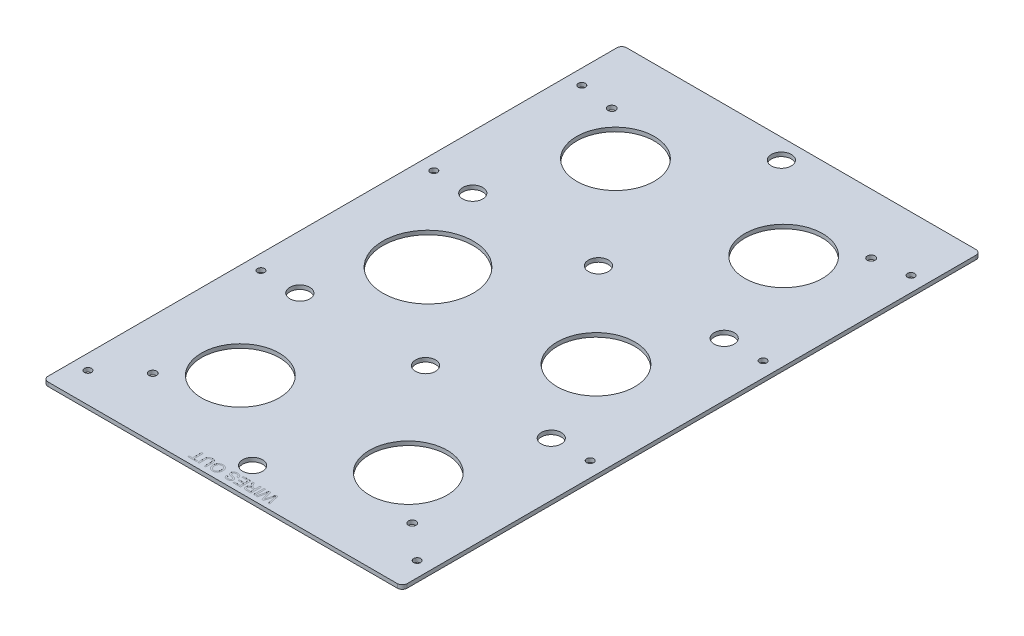
from build123d import *

# Parameters (mm, degrees)
SKETCH1_R           = 24.727
SKETCH1_R_2         = 28.76928198
SKETCH1_R_3         = 6.35
SKETCH1_R_4         = 2.45745
SKETCH1_R_5         = 2.2479
BOSS_EXTRUDE1_DEPTH = 2.54
SKETCH2_W           = 0.941716851
SKETCH2_H           = 6.677628581
CUT_EXTRUDE2_DEPTH  = 0.0254


with BuildPart() as part:
    # Sketch1 → Boss-Extrude1 (new body)
    with BuildSketch(Plane(origin=(0, 0, 0), x_dir=(1, 0, 0), z_dir=(0, 1, 0))):
        with BuildLine():
            Line((-109.77845824, -117.604731416), (112.47154176, -117.604731416))
            ThreePointArc((112.47154176, -117.604731416), (114.71660579, -118.534667386), (115.64654176, -120.779731416))
            Line((115.64654176, -120.779731416), (115.64654176, -482.729731416))
            ThreePointArc((115.64654176, -482.729731416), (114.71660579, -484.974795446), (112.47154176, -485.904731416))
            Line((112.47154176, -485.904731416), (-109.77845824, -485.904731416))
            ThreePointArc((-109.77845824, -485.904731416), (-112.023522271, -484.974795446), (-112.95345824, -482.729731416))
            Line((-112.95345824, -482.729731416), (-112.95345824, -120.779731416))
            ThreePointArc((-112.95345824, -120.779731416), (-112.023522271, -118.534667386), (-109.77845824, -117.604731416))
        make_face()
        with Locations((54.86434176, -421.2633131)):
            Circle(SKETCH1_R, mode=Mode.SUBTRACT)
        with Locations((54.86434176, -301.819022258)):
            Circle(SKETCH1_R, mode=Mode.SUBTRACT)
        with Locations((-52.17125824, -421.134731416)):
            Circle(SKETCH1_R, mode=Mode.SUBTRACT)
        with Locations((-52.17125824, -182.374731416)):
            Circle(SKETCH1_R, mode=Mode.SUBTRACT)
        with Locations((54.86434176, -182.374731416)):
            Circle(SKETCH1_R, mode=Mode.SUBTRACT)
        with Locations((-52.17125824, -301.690440574)):
            Circle(SKETCH1_R_2, mode=Mode.SUBTRACT)
        with Locations((1.34654176, -466.854731416)):
            Circle(SKETCH1_R_3, mode=Mode.SUBTRACT)
        with Locations((81.35654176, -356.783831416)):
            Circle(SKETCH1_R_3, mode=Mode.SUBTRACT)
        with Locations((1.34654176, -356.788064749)):
            Circle(SKETCH1_R_3, mode=Mode.SUBTRACT)
        with Locations((-78.66345824, -356.783831416)):
            Circle(SKETCH1_R_3, mode=Mode.SUBTRACT)
        with Locations((81.35654176, -246.725631416)):
            Circle(SKETCH1_R_3, mode=Mode.SUBTRACT)
        with Locations((1.34654176, -246.721398083)):
            Circle(SKETCH1_R_3, mode=Mode.SUBTRACT)
        with Locations((-78.66345824, -246.725631416)):
            Circle(SKETCH1_R_3, mode=Mode.SUBTRACT)
        with Locations((1.34654176, -130.304731416)):
            Circle(SKETCH1_R_3, mode=Mode.SUBTRACT)
        with Locations((83.89654176, -155.704731416)):
            Circle(SKETCH1_R_4, mode=Mode.SUBTRACT)
        with Locations((-81.20345824, -155.704731416)):
            Circle(SKETCH1_R_4, mode=Mode.SUBTRACT)
        with Locations((-81.20345824, -447.804731416)):
            Circle(SKETCH1_R_4, mode=Mode.SUBTRACT)
        with Locations((83.89654176, -447.804731416)):
            Circle(SKETCH1_R_4, mode=Mode.SUBTRACT)
        with Locations((-103.42845824, -152.529731416)):
            Circle(SKETCH1_R_5, mode=Mode.SUBTRACT)
        with Locations((-103.42845824, -246.721398083)):
            Circle(SKETCH1_R_5, mode=Mode.SUBTRACT)
        with Locations((106.12154176, -152.529731416)):
            Circle(SKETCH1_R_5, mode=Mode.SUBTRACT)
        with Locations((106.12154176, -246.721398083)):
            Circle(SKETCH1_R_5, mode=Mode.SUBTRACT)
        with Locations((106.12154176, -356.788064749)):
            Circle(SKETCH1_R_5, mode=Mode.SUBTRACT)
        with Locations((-103.42845824, -356.788064749)):
            Circle(SKETCH1_R_5, mode=Mode.SUBTRACT)
        with Locations((-103.42845824, -466.854731416)):
            Circle(SKETCH1_R_5, mode=Mode.SUBTRACT)
        with Locations((106.12154176, -466.854731416)):
            Circle(SKETCH1_R_5, mode=Mode.SUBTRACT)
    extrude(amount=BOSS_EXTRUDE1_DEPTH)

    # Sketch2 → Cut-Extrude2 (cut)
    # profile 1 of 8: a face of its own
    with BuildSketch(Plane(origin=(0, 2.54, 0), x_dir=(1, 0, 0), z_dir=(0, 1, 0))):
        with BuildLine():
            Line((26.372131973, -475.904731416), (28.053578112, -482.582359997))
            Line((28.053578112, -482.582359997), (27.081094943, -482.582359997))
            Line((27.081094943, -482.582359997), (26.089884451, -478.190802579))
            add(Edge.make_bspline(
                [(26.089884451, -478.190802579), (26.038513758, -477.964312224), (25.936296825, -477.513643795), (25.835190428, -477.062724924), (25.784896607, -476.838422271)],
                knots=[0, 0, 0, 0, 1.00513078, 2, 2, 2, 2], degree=3))
            add(Edge.make_bspline(
                [(25.784896607, -476.838422271), (25.761084061, -476.919075954), (25.716130312, -477.07133541), (25.655361557, -477.28717786), (25.600167243, -477.47555915), (25.55314452, -477.637357484), (25.515070403, -477.772800178), (25.482197643, -477.880222921), (25.459791981, -477.961729399), (25.446514345, -478.006664191), (25.44111645, -478.024931997)],
                knots=[0, 0, 0, 0, 1.633809233, 3.084334118, 4.356383392, 5.447555203, 6.357852567, 7.089694452, 7.629924063, 8, 8, 8, 8], degree=3))
            Line((25.44111645, -478.024931997), (24.122177792, -482.582359997))
            Line((24.122177792, -482.582359997), (22.989174705, -482.582359997))
            Line((22.989174705, -482.582359997), (22.03541886, -479.236857377))
            add(Edge.make_bspline(
                [(22.03541886, -479.236857377), (21.982784819, -479.030185346), (21.879001879, -478.622672829), (21.741109494, -478.01566784), (21.61383923, -477.423388915), (21.540529167, -477.031660892), (21.504365466, -476.838422271)],
                knots=[0, 0, 0, 0, 1.04154457, 2.053700482, 3.039894486, 4, 4, 4, 4], degree=3))
            add(Edge.make_bspline(
                [(21.504365466, -476.838422271), (21.481984929, -476.936944292), (21.434706341, -477.14507076), (21.362000235, -477.473539991), (21.279481876, -477.83395597), (21.223338384, -478.085100536), (21.194026958, -478.216218233)],
                knots=[0, 0, 0, 0, 0.858436457, 1.813435672, 2.858437265, 4, 4, 4, 4], degree=3))
            Line((21.194026958, -478.216218233), (20.208167129, -482.582359997))
            Line((20.208167129, -482.582359997), (19.235683961, -482.582359997))
            Line((19.235683961, -482.582359997), (20.918467766, -475.904731416))
            Line((20.918467766, -475.904731416), (21.953821235, -475.904731416))
            Line((21.953821235, -475.904731416), (23.349006854, -481.007927136))
            add(Edge.make_bspline(
                [(23.349006854, -481.007927136), (23.363016528, -481.057815617), (23.38962969, -481.152585154), (23.424513314, -481.287824496), (23.45910635, -481.406761932), (23.486621699, -481.510934535), (23.51043393, -481.599292569), (23.531520679, -481.671577335), (23.545083109, -481.729203562), (23.554890828, -481.761956596), (23.559020413, -481.77574741)],
                knots=[0, 0, 0, 0, 1.562239628, 2.967673567, 4.210417925, 5.296319877, 6.215971374, 6.969386481, 7.566055473, 8, 8, 8, 8], degree=3))
            add(Edge.make_bspline(
                [(23.559020413, -481.77574741), (23.583846032, -481.688311611), (23.630871147, -481.522689209), (23.69935552, -481.289823335), (23.758234909, -481.085483445), (23.79487651, -480.959319766), (23.811839284, -480.900913858)],
                knots=[0, 0, 0, 0, 1.197732026, 2.268764715, 3.198546125, 4, 4, 4, 4], degree=3))
            Line((23.811839284, -480.900913858), (25.25785621, -475.904731416))
            Line((25.25785621, -475.904731416), (26.372131973, -475.904731416))
        make_face()
    # profile 2 of 8: a face of its own
    with BuildSketch(Plane(origin=(0, 2.54, 0), x_dir=(1, 0, 0), z_dir=(0, 1, 0))):
        with Locations((18.079940552, -479.243545707)):
            Rectangle(SKETCH2_W, SKETCH2_H)
    # profile 3 of 8: a face of its own
    with BuildSketch(Plane(origin=(0, 2.54, 0), x_dir=(1, 0, 0), z_dir=(0, 1, 0))):
        with BuildLine():
            Line((16.068090916, -475.904731416), (16.068090916, -482.582359997))
            Line((16.068090916, -482.582359997), (13.170706399, -482.582359997))
            add(Edge.make_bspline(
                [(13.170706399, -482.582359997), (13.102481541, -482.581827962), (12.970440312, -482.580798272), (12.778958565, -482.573440351), (12.600651852, -482.557808443), (12.434396409, -482.540349513), (12.280476723, -482.514571062), (12.13881944, -482.48432829), (12.009967848, -482.448584849), (11.892941528, -482.40633462), (11.784357797, -482.358550478), (11.683737524, -482.299559989), (11.58676027, -482.235030329), (11.497291762, -482.158586204), (11.41130237, -482.076455256), (11.332392217, -481.98452804), (11.25822596, -481.885105409), (11.16804959, -481.741131601), (11.073339849, -481.548144969), (10.991764744, -481.302957418), (10.939893748, -481.046216606), (10.934294461, -480.870841687), (10.931453546, -480.781861585)],
                knots=[0, 0, 0, 0, 1.242075696, 2.40389213, 3.487198984, 4.500157661, 5.446319301, 6.326791195, 7.136300648, 7.878370406, 8.590488565, 9.292260633, 9.999224673, 10.708050372, 11.431369221, 12.162165018, 12.910600795, 13.687589445, 15.252257874, 16.810406251, 18.381693487, 20, 20, 20, 20], degree=3))
            add(Edge.make_bspline(
                [(10.931453546, -480.781861585), (10.932760252, -480.724740088), (10.935341085, -480.611921213), (10.955110239, -480.446047086), (10.990881693, -480.287561728), (11.036749024, -480.135073876), (11.099536767, -479.990755988), (11.172240397, -479.851615869), (11.262436911, -479.721641487), (11.363146153, -479.596488972), (11.480252773, -479.481806219), (11.610515046, -479.375811763), (11.757849182, -479.284850699), (11.917422891, -479.200318383), (12.093348641, -479.130895346), (12.282973305, -479.069766111), (12.487764473, -479.022633746), (12.629708281, -478.998892657), (12.702523306, -478.986713838)],
                knots=[0, 0, 0, 0, 0.982645791, 1.940792824, 2.867691729, 3.775150443, 4.675643875, 5.571354211, 6.471357401, 7.392684514, 8.331098131, 9.285922955, 10.275520706, 11.304845665, 12.388884831, 13.524255008, 14.729980297, 16, 16, 16, 16], degree=3))
            add(Edge.make_bspline(
                [(12.702523306, -478.986713838), (12.648592947, -478.95983205), (12.546318845, -478.908853145), (12.407145687, -478.824504804), (12.285223811, -478.745098059), (12.215967152, -478.685554196), (12.183508905, -478.657648006)],
                knots=[0, 0, 0, 0, 1.172551213, 2.223638478, 3.167479604, 4, 4, 4, 4], degree=3))
            add(Edge.make_bspline(
                [(12.183508905, -478.657648006), (12.120320754, -478.595895573), (11.990732262, -478.4692515), (11.81389184, -478.251539052), (11.63891035, -478.01211767), (11.533855118, -477.8376469), (11.479896599, -477.748035139)],
                knots=[0, 0, 0, 0, 0.918170575, 1.883016652, 2.912673989, 4, 4, 4, 4], degree=3))
            Line((11.479896599, -477.748035139), (10.38434816, -475.904731416))
            Line((10.38434816, -475.904731416), (11.463844607, -475.904731416))
            Line((11.463844607, -475.904731416), (12.295872847, -477.314631361))
            add(Edge.make_bspline(
                [(12.295872847, -477.314631361), (12.325790236, -477.364098167), (12.383765222, -477.459956715), (12.467478002, -477.599973664), (12.54966608, -477.728808538), (12.625523723, -477.850471976), (12.699861709, -477.961755466), (12.76650074, -478.066870579), (12.833423708, -478.159862494), (12.910266128, -478.271581699), (13.004109879, -478.392370364), (13.113618902, -478.516455456), (13.214305162, -478.619242035), (13.34153795, -478.717314097), (13.499745251, -478.807108645), (13.633136567, -478.849704776), (13.697746796, -478.870336898)],
                knots=[0, 0, 0, 0, 1.130591283, 2.190900266, 3.190104209, 4.119071823, 4.994606968, 5.807262858, 6.55236009, 7.234593472, 8.459046683, 9.540234366, 10.471327768, 11.266723835, 12.676093724, 14, 14, 14, 14], degree=3))
            add(Edge.make_bspline(
                [(13.697746796, -478.870336898), (13.724889433, -478.875231638), (13.786856888, -478.886406476), (13.89207747, -478.89370478), (14.019565115, -478.901450954), (14.111957583, -478.901225256), (14.161916892, -478.901103215)],
                knots=[0, 0, 0, 0, 0.709978628, 1.620902492, 2.713552433, 4, 4, 4, 4], degree=3))
            Line((14.161916892, -478.901103215), (15.126374065, -478.901103215))
            Line((15.126374065, -478.901103215), (15.126374065, -475.904731416))
            Line((15.126374065, -475.904731416), (16.068090916, -475.904731416))
        make_face()
        with BuildLine():
            Line((15.126374065, -479.671598821), (13.337914647, -479.671598821))
            add(Edge.make_bspline(
                [(13.337914647, -479.671598821), (13.248230464, -479.672989815), (13.080574296, -479.67559015), (12.846193265, -479.698134703), (12.645703404, -479.733375071), (12.476543745, -479.786899254), (12.334381546, -479.858578696), (12.211169235, -479.946235717), (12.107569198, -480.054984869), (12.022367114, -480.17968191), (11.955762337, -480.315575815), (11.909222295, -480.459402831), (11.877976942, -480.608405004), (11.874782155, -480.710360449), (11.873170397, -480.761796596)],
                knots=[0, 0, 0, 0, 1.546056516, 2.890207646, 4.055830773, 5.050253158, 5.937355789, 6.790906573, 7.644595853, 8.512568064, 9.38593768, 10.244184789, 11.114197691, 12, 12, 12, 12], degree=3))
            add(Edge.make_bspline(
                [(11.873170397, -480.761796596), (11.874407733, -480.799281171), (11.876831311, -480.872702444), (11.889671729, -480.98042932), (11.914101739, -481.082517958), (11.947836256, -481.179704261), (11.990549077, -481.272199236), (12.043036377, -481.359639094), (12.105027325, -481.441577229), (12.17613821, -481.518417024), (12.257757732, -481.58834434), (12.350994391, -481.648673601), (12.455103649, -481.69994125), (12.570209115, -481.740630467), (12.695947439, -481.773175281), (12.833034639, -481.79482628), (12.980843722, -481.810492876), (13.083266847, -481.811398678), (13.135927084, -481.811864391)],
                knots=[0, 0, 0, 0, 0.965235723, 1.89061323, 2.787065514, 3.661873922, 4.534873316, 5.404925039, 6.281839248, 7.175200054, 8.095223355, 9.040740021, 10.02630299, 11.075573487, 12.177989335, 13.364883635, 14.645170704, 16, 16, 16, 16], degree=3))
            Line((13.135927084, -481.811864391), (15.126374065, -481.811864391))
            Line((15.126374065, -481.811864391), (15.126374065, -479.671598821))
        make_face(mode=Mode.SUBTRACT)
    # profile 4 of 8: a face of its own
    with BuildSketch(Plane(origin=(0, 2.54, 0), x_dir=(1, 0, 0), z_dir=(0, 1, 0))):
        Polygon((9.390462335, -475.904731416), (9.390462335, -482.582359997), (4.681878079, -482.582359997), (4.681878079, -481.811864391), (8.448745484, -481.811864391), (8.448745484, -479.757209443), (4.938709948, -479.757209443), (4.938709948, -478.986713838), (8.448745484, -478.986713838), (8.448745484, -476.675227022), (4.510656834, -476.675227022), (4.510656834, -475.904731416), align=None)
    # profile 5 of 8: a face of its own
    with BuildSketch(Plane(origin=(0, 2.54, 0), x_dir=(1, 0, 0), z_dir=(0, 1, 0))):
        with BuildLine():
            Line((3.568939983, -478.216218233), (2.627223132, -478.216218233))
            add(Edge.make_bspline(
                [(2.627223132, -478.216218233), (2.616888429, -478.131652183), (2.597034909, -477.969196247), (2.541083006, -477.739143921), (2.47059671, -477.531765305), (2.377850268, -477.347273237), (2.263933602, -477.181277245), (2.121405984, -477.034274944), (1.950254913, -476.905232553), (1.754515474, -476.794893332), (1.540336943, -476.7019483), (1.3096099, -476.636745749), (1.065749368, -476.59720687), (0.898664382, -476.592182119), (0.81334806, -476.589616399)],
                knots=[0, 0, 0, 0, 1.125761249, 2.162647979, 3.12492346, 4.01623828, 4.884793378, 5.777219259, 6.711258599, 7.709587174, 8.742442187, 9.791331093, 10.872217593, 12, 12, 12, 12], degree=3))
            add(Edge.make_bspline(
                [(0.81334806, -476.589616399), (0.737864455, -476.591020078), (0.59112768, -476.59374877), (0.378013511, -476.626314589), (0.17804448, -476.674492858), (-0.006619059, -476.743784278), (-0.172265947, -476.830884243), (-0.31929873, -476.930338577), (-0.441246868, -477.048862493), (-0.539890767, -477.17986137), (-0.616443955, -477.318970535), (-0.669814148, -477.462482959), (-0.705746458, -477.607604013), (-0.709652166, -477.705916251), (-0.711591159, -477.754723469)],
                knots=[0, 0, 0, 0, 1.267544124, 2.464049433, 3.614542348, 4.719673496, 5.768837234, 6.754183997, 7.692231426, 8.612479311, 9.501217876, 10.350240008, 11.180974857, 12, 12, 12, 12], degree=3))
            add(Edge.make_bspline(
                [(-0.711591159, -477.754723469), (-0.709545483, -477.803051819), (-0.705543104, -477.897606546), (-0.673793085, -478.03448118), (-0.622488204, -478.161839203), (-0.550520051, -478.280767085), (-0.452708935, -478.390545656), (-0.326227404, -478.487996323), (-0.174598831, -478.58068759), (-0.060437884, -478.630119962), (4.7143e-05, -478.656310341)],
                knots=[0, 0, 0, 0, 0.942081658, 1.843188798, 2.725198023, 3.611401405, 4.541884661, 5.575766242, 6.715586633, 8, 8, 8, 8], degree=3))
            add(Edge.make_bspline(
                [(4.7143e-05, -478.656310341), (0.023572716, -478.665964594), (0.076721257, -478.687775307), (0.16781625, -478.716645948), (0.275907374, -478.753995036), (0.403206268, -478.792260466), (0.549844832, -478.833260146), (0.714477965, -478.880444223), (0.898411765, -478.929579011), (1.095204731, -478.981595403), (1.294403097, -479.034355039), (1.484686558, -479.088300752), (1.660836148, -479.139465805), (1.822181357, -479.19205191), (1.968876697, -479.243952649), (2.101322941, -479.294832643), (2.219755695, -479.343425756), (2.292088144, -479.379162423), (2.326248286, -479.396039628)],
                knots=[0, 0, 0, 0, 0.499208779, 1.12780332, 1.87546358, 2.745246929, 3.737578632, 4.865834649, 6.108484299, 7.476352792, 8.863398792, 10.155242256, 11.360521946, 12.465428895, 13.487415091, 14.415997097, 15.251929613, 16, 16, 16, 16], degree=3))
            add(Edge.make_bspline(
                [(2.326248286, -479.396039628), (2.404791645, -479.438549093), (2.556400769, -479.520603422), (2.761240162, -479.666445689), (2.930939575, -479.831435602), (3.070884822, -480.009204512), (3.178931729, -480.200673688), (3.255268977, -480.403746025), (3.304844842, -480.617629242), (3.309660052, -480.76464044), (3.312108114, -480.839381223)],
                knots=[0, 0, 0, 0, 1.158956011, 2.237086722, 3.252429106, 4.221720014, 5.165272549, 6.094237939, 7.031106807, 8, 8, 8, 8], degree=3))
            add(Edge.make_bspline(
                [(3.312108114, -480.839381223), (3.308934235, -480.922169384), (3.302621412, -481.086834437), (3.246483312, -481.328422791), (3.157071789, -481.561652776), (3.054077226, -481.746243423), (2.955105169, -481.886400222), (2.871924183, -481.985780629), (2.780137124, -482.078203422), (2.681751252, -482.165586195), (2.573214237, -482.244661593), (2.457777151, -482.318074619), (2.333075292, -482.383860466), (2.156523463, -482.464065642), (1.921695099, -482.546297072), (1.626026181, -482.617541618), (1.314822683, -482.659247391), (1.102409163, -482.665021748), (0.993932968, -482.66797062)],
                knots=[0, 0, 0, 0, 1.200056028, 2.386902731, 3.579012093, 4.815906327, 5.442508847, 6.067203999, 6.694073756, 7.331409728, 7.974631341, 8.640655778, 9.315145047, 10.018831381, 11.453504181, 12.917815188, 14.425977399, 16, 16, 16, 16], degree=3))
            add(Edge.make_bspline(
                [(0.993932968, -482.66797062), (0.875180391, -482.665335452), (0.644388449, -482.660214087), (0.308800897, -482.615048168), (-0.005136566, -482.542269778), (-0.250888059, -482.456526219), (-0.433050358, -482.371298161), (-0.561451198, -482.302618852), (-0.681042222, -482.225216619), (-0.794105541, -482.143262026), (-0.896600506, -482.051416675), (-0.992760264, -481.95451086), (-1.080967092, -481.850676539), (-1.185715223, -481.702375157), (-1.296360105, -481.504042733), (-1.396282217, -481.249659933), (-1.460268613, -480.979183734), (-1.474736722, -480.7933387), (-1.482086764, -480.698926295)],
                knots=[0, 0, 0, 0, 1.607451709, 3.124032445, 4.575401297, 5.965664223, 6.638286369, 7.297495781, 7.935629741, 8.566004073, 9.186263309, 9.796807256, 10.413736732, 11.028594479, 12.253110936, 13.478624344, 14.719098735, 16, 16, 16, 16], degree=3))
            Line((-1.482086764, -480.698926295), (-0.540369913, -480.698926295))
            add(Edge.make_bspline(
                [(-0.540369913, -480.698926295), (-0.534582867, -480.746790135), (-0.523247688, -480.840541808), (-0.491448259, -480.975279325), (-0.453411532, -481.101835006), (-0.405043453, -481.218786484), (-0.347317512, -481.327167922), (-0.278844978, -481.425743174), (-0.202335906, -481.516377881), (-0.115944415, -481.597481453), (-0.018853149, -481.66870712), (0.088958226, -481.730263898), (0.207089978, -481.782876538), (0.336687983, -481.823436732), (0.476019365, -481.857118748), (0.626687106, -481.881296537), (0.788164484, -481.893821225), (0.899385479, -481.896235632), (0.95647832, -481.897475014)],
                knots=[0, 0, 0, 0, 1.074256797, 2.104164074, 3.082231143, 4.018364317, 4.921387537, 5.814946689, 6.689553043, 7.561782592, 8.450683137, 9.368204304, 10.325224224, 11.328240899, 12.391723181, 13.519579538, 14.726730929, 16, 16, 16, 16], degree=3))
            add(Edge.make_bspline(
                [(0.95647832, -481.897475014), (1.015824507, -481.897033587), (1.130704129, -481.896179094), (1.296741072, -481.880315804), (1.450760463, -481.858931698), (1.591812846, -481.826106316), (1.721214446, -481.787486496), (1.83669551, -481.735627275), (1.941008437, -481.677168085), (2.032250836, -481.608644046), (2.110894725, -481.532675231), (2.181478644, -481.454638279), (2.23839124, -481.37045065), (2.288505712, -481.284774031), (2.323423369, -481.193051669), (2.350832938, -481.099274119), (2.36749946, -481.001380567), (2.369414008, -480.934865537), (2.370391263, -480.900913858)],
                knots=[0, 0, 0, 0, 1.464224776, 2.834379057, 4.11387117, 5.299348816, 6.406355048, 7.441191667, 8.417293255, 9.352838038, 10.248153785, 11.113750317, 11.944205591, 12.75240885, 13.557683963, 14.358962649, 15.162355132, 16, 16, 16, 16], degree=3))
            add(Edge.make_bspline(
                [(2.370391263, -480.900913858), (2.367957645, -480.843462477), (2.363234217, -480.731954643), (2.315001109, -480.573535625), (2.240818252, -480.429126425), (2.167736318, -480.350554117), (2.130949052, -480.31100316)],
                knots=[0, 0, 0, 0, 1.050964922, 2.039826012, 3.013306874, 4, 4, 4, 4], degree=3))
            add(Edge.make_bspline(
                [(2.130949052, -480.31100316), (2.107758753, -480.291237481), (2.056474838, -480.247526901), (1.961053185, -480.189681153), (1.842744605, -480.131234951), (1.700757933, -480.073137007), (1.535340432, -480.014670252), (1.346745518, -479.954515149), (1.133898346, -479.894461366), (0.903847292, -479.837528445), (0.671767285, -479.779071519), (0.451520704, -479.72147128), (0.248516937, -479.667642831), (0.065093387, -479.61160268), (-0.101768138, -479.562447621), (-0.248759992, -479.51054747), (-0.378522975, -479.463448691), (-0.457988985, -479.430204154), (-0.49488927, -479.414766952)],
                knots=[0, 0, 0, 0, 0.523895407, 1.158562347, 1.913798076, 2.79478753, 3.797549825, 4.933675542, 6.202127117, 7.604032848, 9.013379355, 10.32225155, 11.523321485, 12.628397413, 13.623935419, 14.51727859, 15.311493772, 16, 16, 16, 16], degree=3))
            add(Edge.make_bspline(
                [(-0.49488927, -479.414766952), (-0.542910388, -479.392642663), (-0.637167797, -479.34921639), (-0.770540481, -479.274857982), (-0.89580028, -479.198303761), (-1.00904669, -479.113945073), (-1.115844417, -479.029473553), (-1.210746291, -478.938152653), (-1.295793705, -478.84213119), (-1.39653614, -478.710201197), (-1.499874762, -478.532129366), (-1.588661265, -478.301983909), (-1.644199518, -478.056092742), (-1.650234274, -477.88655586), (-1.65330801, -477.800204112)],
                knots=[0, 0, 0, 0, 0.899363591, 1.76530001, 2.59691609, 3.395188894, 4.166615117, 4.912545108, 5.632755751, 6.347510175, 7.734752518, 9.118421309, 10.532299558, 12, 12, 12, 12], degree=3))
            add(Edge.make_bspline(
                [(-1.65330801, -477.800204112), (-1.649767995, -477.712947481), (-1.642722215, -477.539278427), (-1.583840983, -477.283670735), (-1.489364027, -477.036498404), (-1.380016111, -476.840406238), (-1.276239511, -476.690405381), (-1.189090737, -476.582582695), (-1.092440104, -476.482886624), (-0.988676047, -476.388190253), (-0.876990111, -476.300428246), (-0.756442938, -476.219563988), (-0.628300624, -476.144780917), (-0.445342044, -476.053551254), (-0.202052756, -475.958813104), (0.10689669, -475.876641079), (0.433681917, -475.827950211), (0.657567256, -475.82210519), (0.771880415, -475.819120793)],
                knots=[0, 0, 0, 0, 1.196987384, 2.382393894, 3.582009067, 4.820735309, 5.454243406, 6.085350439, 6.72189866, 7.359035515, 8.013098289, 8.67027723, 9.350744424, 10.048966745, 11.475869723, 12.9268444, 14.430883741, 16, 16, 16, 16], degree=3))
            add(Edge.make_bspline(
                [(0.771880415, -475.819120793), (0.844576759, -475.819797777), (0.987423519, -475.821128036), (1.19686209, -475.83431666), (1.396995926, -475.858144771), (1.588625711, -475.885725106), (1.770847441, -475.927177668), (1.9447067, -475.973949607), (2.108617605, -476.032626587), (2.264385116, -476.097184112), (2.410583191, -476.173465379), (2.550281482, -476.255221012), (2.680099408, -476.349004708), (2.803883278, -476.448461662), (2.917898251, -476.559105701), (3.023463518, -476.678354849), (3.121726472, -476.805938118), (3.210945033, -476.941993436), (3.290592333, -477.084960745), (3.362294798, -477.23235512), (3.422300493, -477.384962788), (3.47175017, -477.542424979), (3.512228266, -477.704026887), (3.541090382, -477.870844972), (3.562042469, -478.041832706), (3.566627231, -478.157746378), (3.568939983, -478.216218233)],
                knots=[0, 0, 0, 0, 1.259929758, 2.475735005, 3.634725603, 4.752877801, 5.82919746, 6.871690464, 7.871395985, 8.84458164, 9.791640072, 10.727373556, 11.647336026, 12.564665335, 13.477425593, 14.397128332, 15.323044476, 16.266184727, 17.214251675, 18.157898412, 19.105082968, 20.053433368, 21.01687335, 21.990151059, 22.98614553, 24, 24, 24, 24], degree=3))
        make_face()
    # profile 6 of 8: a face of its own
    with BuildSketch(Plane(origin=(0, 2.54, 0), x_dir=(1, 0, 0), z_dir=(0, 1, 0))):
        with BuildLine():
            add(Edge.make_bspline(
                [(-5.163343546, -479.155259752), (-5.165680088, -479.289135529), (-5.170232722, -479.549985692), (-5.212269125, -479.929899077), (-5.281617139, -480.286921252), (-5.37701251, -480.622703732), (-5.5038915, -480.934714085), (-5.654439866, -481.226789018), (-5.83710406, -481.493844928), (-6.043502744, -481.738969607), (-6.27410383, -481.955657917), (-6.519612451, -482.148113422), (-6.783113465, -482.308642761), (-7.062167308, -482.441187416), (-7.357960891, -482.542951276), (-7.669663359, -482.614195261), (-7.996941445, -482.660154548), (-8.220643673, -482.665327419), (-8.334949589, -482.66797062)],
                knots=[0, 0, 0, 0, 1.203593535, 2.345140965, 3.431924157, 4.471254512, 5.478692091, 6.45615896, 7.42038538, 8.382007041, 9.33218277, 10.260966195, 11.182476517, 12.100814648, 13.034113903, 13.98924309, 14.972556454, 16, 16, 16, 16], degree=3))
            add(Edge.make_bspline(
                [(-8.334949589, -482.66797062), (-8.41034457, -482.666666047), (-8.560065365, -482.664075401), (-8.781811369, -482.643970034), (-8.997592744, -482.609061507), (-9.207535956, -482.560498158), (-9.411950682, -482.499400427), (-9.610701977, -482.423941081), (-9.804107431, -482.335665273), (-9.990435355, -482.233067288), (-10.168362457, -482.117618035), (-10.33716252, -481.99251744), (-10.494213104, -481.855256349), (-10.640272121, -481.707656459), (-10.776468607, -481.549793667), (-10.89845001, -481.378719662), (-11.013436254, -481.199837338), (-11.114249682, -481.009040243), (-11.205639413, -480.810712696), (-11.282243523, -480.603995115), (-11.35008298, -480.391850055), (-11.404859542, -480.172959882), (-11.445690423, -479.946700078), (-11.47708771, -479.714696505), (-11.494041527, -479.475659739), (-11.497020979, -479.314465609), (-11.498529635, -479.232844379)],
                knots=[0, 0, 0, 0, 1.034176269, 2.053687022, 3.051235935, 4.030520976, 5.007759882, 5.975670013, 6.944584641, 7.921900115, 8.890679583, 9.85222947, 10.801660264, 11.7488817, 12.698942795, 13.658174729, 14.62880618, 15.613957309, 16.61577279, 17.622338666, 18.636016077, 19.670029534, 20.714984856, 21.788550191, 22.880224384, 24, 24, 24, 24], degree=3))
            add(Edge.make_bspline(
                [(-11.498529635, -479.232844379), (-11.497138305, -479.149878825), (-11.494389493, -478.985966068), (-11.475789903, -478.743816775), (-11.44308536, -478.508619086), (-11.399708352, -478.279671684), (-11.341584485, -478.05745119), (-11.2725132, -477.841320483), (-11.188967583, -477.632566885), (-11.094612071, -477.430687242), (-10.987848896, -477.238458153), (-10.870081699, -477.057223581), (-10.741227823, -476.888679534), (-10.603241729, -476.730755832), (-10.453364647, -476.58672136), (-10.292754238, -476.454432261), (-10.121738946, -476.33445772), (-9.940989121, -476.226090066), (-9.753392523, -476.13080257), (-9.561226957, -476.046594873), (-9.364265788, -475.978463632), (-9.165390597, -475.918034174), (-8.96163999, -475.874582309), (-8.754935237, -475.842203665), (-8.543977653, -475.823270241), (-8.402315192, -475.82051105), (-8.330936591, -475.819120793)],
                knots=[0, 0, 0, 0, 1.141458971, 2.255149016, 3.338763392, 4.407145747, 5.45911027, 6.497028761, 7.526847988, 8.550472592, 9.561035647, 10.549629976, 11.521388012, 12.477647518, 13.432134385, 14.377847498, 15.337760086, 16.303574593, 17.274809663, 18.230970776, 19.187525402, 20.140611526, 21.088808525, 22.051011914, 23.017975238, 24, 24, 24, 24], degree=3))
            add(Edge.make_bspline(
                [(-8.330936591, -475.819120793), (-8.254198792, -475.820309681), (-8.102200431, -475.82266457), (-7.877305336, -475.844345492), (-7.658748879, -475.881460676), (-7.445280811, -475.928050436), (-7.239276647, -475.993461052), (-7.039012754, -476.070530878), (-6.845973798, -476.163796859), (-6.659168071, -476.269154763), (-6.480268972, -476.385959466), (-6.313069451, -476.515335396), (-6.155102477, -476.652739616), (-6.011179069, -476.803499345), (-5.87698884, -476.962898302), (-5.752982447, -477.132319795), (-5.64091208, -477.312612503), (-5.541398784, -477.502812003), (-5.451664197, -477.698091438), (-5.376019931, -477.898348896), (-5.309554491, -478.100677047), (-5.256618727, -478.30631126), (-5.214436106, -478.514780295), (-5.186071175, -478.725736434), (-5.165585856, -478.939494085), (-5.164094744, -479.082975927), (-5.163343546, -479.155259752)],
                knots=[0, 0, 0, 0, 1.072846099, 2.125039441, 3.155166917, 4.171599398, 5.177324298, 6.174217088, 7.169783185, 8.172042761, 9.17156421, 10.154239632, 11.126115549, 12.096189878, 13.065322046, 14.038037562, 15.029377678, 16.03062832, 17.03785952, 18.032507603, 19.022297599, 20.014323703, 20.999862951, 21.994471951, 22.989647507, 24, 24, 24, 24], degree=3))
        make_face()
        with BuildLine():
            add(Edge.make_bspline(
                [(-6.105060397, -479.144558424), (-6.106502716, -479.048151817), (-6.109315136, -478.860165739), (-6.141520317, -478.586099128), (-6.190329069, -478.32747685), (-6.257803659, -478.083694111), (-6.347890465, -477.856543018), (-6.458032203, -477.645587371), (-6.587231185, -477.449830078), (-6.735419429, -477.271489589), (-6.898245646, -477.111226752), (-7.072244838, -476.97118446), (-7.257255358, -476.854408047), (-7.450827693, -476.756869438), (-7.655528362, -476.681716297), (-7.870376655, -476.628589759), (-8.095368355, -476.595428666), (-8.248776896, -476.591577959), (-8.326923593, -476.589616399)],
                knots=[0, 0, 0, 0, 1.215616022, 2.370365452, 3.475740397, 4.533490648, 5.5560781, 6.552384115, 7.530550651, 8.509299237, 9.471863928, 10.40830403, 11.321168121, 12.226759389, 13.137923578, 14.065605683, 15.014614662, 16, 16, 16, 16], degree=3))
            add(Edge.make_bspline(
                [(-8.326923593, -476.589616399), (-8.406395583, -476.591605556), (-8.562001517, -476.595500319), (-8.790375301, -476.628101993), (-9.007355981, -476.683604945), (-9.21509413, -476.757491975), (-9.409834377, -476.857374543), (-9.596129891, -476.974336845), (-9.768906947, -477.117260032), (-9.932388353, -477.277811023), (-10.079074978, -477.460286231), (-10.209019133, -477.660286468), (-10.315304872, -477.880297116), (-10.40396623, -478.117154096), (-10.473513735, -478.372343821), (-10.522133953, -478.645864052), (-10.552117644, -478.936993788), (-10.555220064, -479.136903238), (-10.556812784, -479.239532709)],
                knots=[0, 0, 0, 0, 0.976909331, 1.912785716, 2.828990727, 3.727421029, 4.617481149, 5.514840137, 6.426786422, 7.368873452, 8.327895072, 9.299698503, 10.295216142, 11.325792517, 12.405818789, 13.542541501, 14.738390493, 16, 16, 16, 16], degree=3))
            add(Edge.make_bspline(
                [(-10.556812784, -479.239532709), (-10.556244201, -479.305554772), (-10.555128847, -479.435066167), (-10.540357803, -479.625967441), (-10.521305079, -479.810930612), (-10.49229691, -479.989716918), (-10.452320322, -480.161586304), (-10.40803186, -480.327845986), (-10.352655123, -480.487067658), (-10.289806816, -480.63985966), (-10.219537234, -480.78549569), (-10.140078017, -480.922538432), (-10.053117135, -481.0514426), (-9.957753735, -481.171632766), (-9.856398629, -481.284806113), (-9.745825306, -481.388020439), (-9.627855289, -481.483329151), (-9.502473817, -481.569757222), (-9.371693041, -481.647449459), (-9.236176692, -481.714452815), (-9.096356433, -481.771258814), (-8.95237602, -481.815771008), (-8.805101772, -481.852520297), (-8.654178528, -481.879741754), (-8.498423708, -481.894013149), (-8.393386573, -481.896312772), (-8.340300253, -481.897475014)],
                knots=[0, 0, 0, 0, 1.220320263, 2.393826742, 3.538159925, 4.657606474, 5.739544833, 6.799495376, 7.837090465, 8.853610905, 9.852768056, 10.824163015, 11.779900663, 12.724912201, 13.658747054, 14.586045767, 15.518168864, 16.460299482, 17.399069918, 18.328125852, 19.252745725, 20.186143833, 21.111865538, 22.057883325, 23.018444021, 24, 24, 24, 24], degree=3))
            add(Edge.make_bspline(
                [(-8.340300253, -481.897475014), (-8.265272613, -481.895959775), (-8.116792917, -481.892961117), (-7.898834425, -481.860557085), (-7.688467122, -481.811773411), (-7.487158619, -481.741307864), (-7.292614517, -481.652843413), (-7.107073622, -481.542701808), (-6.929355143, -481.41319321), (-6.76021434, -481.264868688), (-6.602569474, -481.093751276), (-6.469222398, -480.892139307), (-6.356854868, -480.664699542), (-6.263024014, -480.412050312), (-6.191482416, -480.13222286), (-6.142037761, -479.826424994), (-6.110819544, -479.494333415), (-6.10702919, -479.264130757), (-6.105060397, -479.144558424)],
                knots=[0, 0, 0, 0, 0.895098135, 1.771399171, 2.624879489, 3.470001555, 4.31324378, 5.172350046, 6.041214072, 6.935108351, 7.854676913, 8.809932058, 9.809814619, 10.877726151, 12.02168834, 13.252153056, 14.572707754, 16, 16, 16, 16], degree=3))
        make_face(mode=Mode.SUBTRACT)
    # profile 7 of 8: a face of its own
    with BuildSketch(Plane(origin=(0, 2.54, 0), x_dir=(1, 0, 0), z_dir=(0, 1, 0))):
        with BuildLine():
            Line((-16.891998874, -482.582359997), (-17.833715725, -482.582359997))
            Line((-17.833715725, -482.582359997), (-17.833715725, -478.740583297))
            add(Edge.make_bspline(
                [(-17.833715725, -478.740583297), (-17.832736276, -478.65897922), (-17.830830266, -478.50017755), (-17.822111199, -478.268576242), (-17.804963285, -478.049869969), (-17.779284613, -477.844731811), (-17.748596087, -477.651891603), (-17.712340947, -477.472000632), (-17.666140371, -477.305219306), (-17.614282628, -477.149716853), (-17.552530521, -477.004123123), (-17.47950781, -476.866349763), (-17.395582764, -476.735531599), (-17.299809233, -476.611956559), (-17.193709357, -476.49487412), (-17.076034537, -476.385210389), (-16.946256675, -476.283724093), (-16.80766629, -476.186578671), (-16.656613704, -476.099700665), (-16.493431408, -476.024763303), (-16.319166444, -475.960305959), (-16.132970286, -475.908486233), (-15.935697447, -475.868884286), (-15.727633655, -475.839272061), (-15.508264391, -475.821768164), (-15.358173803, -475.820016319), (-15.281449032, -475.819120793)],
                knots=[0, 0, 0, 0, 1.311377147, 2.551942077, 3.723550895, 4.835332178, 5.873100029, 6.860965504, 7.782222652, 8.65229484, 9.493385443, 10.320318369, 11.155067733, 11.987723446, 12.829729107, 13.691560723, 14.568860379, 15.475173283, 16.409214366, 17.364531151, 18.357450607, 19.391849073, 20.466818896, 21.588529868, 22.767281177, 24, 24, 24, 24], degree=3))
            add(Edge.make_bspline(
                [(-15.281449032, -475.819120793), (-15.206518449, -475.820223431), (-15.060522054, -475.822371835), (-14.846578966, -475.83690841), (-14.643065343, -475.862643957), (-14.449397823, -475.896498272), (-14.266530231, -475.941994513), (-14.094681069, -475.998599924), (-13.932730482, -476.063888639), (-13.780481698, -476.138431495), (-13.640207329, -476.225159239), (-13.508293205, -476.317782697), (-13.388641604, -476.422155702), (-13.278948801, -476.534346179), (-13.179050989, -476.655276232), (-13.090905536, -476.786099146), (-13.011096574, -476.924938713), (-12.944856314, -477.075383033), (-12.885052085, -477.235955846), (-12.834930763, -477.41003356), (-12.792133476, -477.597616374), (-12.758091687, -477.799137402), (-12.729203239, -478.014518169), (-12.712001565, -478.244543636), (-12.699075091, -478.488063667), (-12.697755454, -478.654953209), (-12.697078355, -478.740583297)],
                knots=[0, 0, 0, 0, 1.193078897, 2.324621146, 3.412165798, 4.458033356, 5.453301711, 6.409727336, 7.336550967, 8.231923267, 9.10494906, 9.959977801, 10.795507141, 11.62892236, 12.456145611, 13.289107106, 14.138012467, 15.002334476, 15.903094886, 16.864671381, 17.884255983, 18.965082669, 20.117808422, 21.342986352, 22.636701193, 24, 24, 24, 24], degree=3))
            Line((-12.697078355, -478.740583297), (-12.697078355, -482.582359997))
            Line((-12.697078355, -482.582359997), (-13.638795206, -482.582359997))
            Line((-13.638795206, -482.582359997), (-13.638795206, -478.784726275))
            add(Edge.make_bspline(
                [(-13.638795206, -478.784726275), (-13.639411254, -478.715610273), (-13.640599927, -478.582249929), (-13.646784809, -478.389060798), (-13.659205573, -478.209788524), (-13.674370542, -478.044572253), (-13.69569169, -477.893653433), (-13.72249348, -477.75712261), (-13.752781924, -477.634189182), (-13.797944179, -477.490303673), (-13.87401122, -477.330314323), (-13.989225226, -477.157600506), (-14.136925159, -477.01256749), (-14.308056294, -476.889554724), (-14.503614766, -476.793613773), (-14.720157606, -476.723776523), (-14.957462775, -476.681955602), (-15.122538963, -476.677520045), (-15.207877403, -476.675227022)],
                knots=[0, 0, 0, 0, 1.090438201, 2.104016592, 3.048763244, 3.925116223, 4.720979001, 5.45216101, 6.119252661, 6.717681473, 7.82855347, 8.901677854, 9.976092604, 11.075141713, 12.213970494, 13.397440122, 14.654570346, 16, 16, 16, 16], degree=3))
            add(Edge.make_bspline(
                [(-15.207877403, -476.675227022), (-15.28104169, -476.676471385), (-15.422314523, -476.678874124), (-15.626021151, -476.69828557), (-15.812788487, -476.733590543), (-15.984491186, -476.779444162), (-16.139744185, -476.840928643), (-16.279662524, -476.915387077), (-16.400545701, -477.00688453), (-16.509923006, -477.109593678), (-16.602287468, -477.234626717), (-16.679471039, -477.383214985), (-16.746035288, -477.555481131), (-16.800545696, -477.753062546), (-16.840353598, -477.976197948), (-16.871452414, -478.223492495), (-16.887763856, -478.49602024), (-16.890546563, -478.685720593), (-16.891998874, -478.784726275)],
                knots=[0, 0, 0, 0, 1.111591514, 2.146370713, 3.104407205, 3.996889121, 4.842307775, 5.6365848, 6.396727704, 7.139400744, 7.909024799, 8.745519786, 9.676513234, 10.710427131, 11.854494362, 13.117490512, 14.495602074, 16, 16, 16, 16], degree=3))
            Line((-16.891998874, -478.784726275), (-16.891998874, -482.582359997))
        make_face()
    # profile 8 of 8: a face of its own
    with BuildSketch(Plane(origin=(0, 2.54, 0), x_dir=(1, 0, 0), z_dir=(0, 1, 0))):
        Polygon((-21.001308769, -475.904731416), (-21.001308769, -481.811864391), (-18.861043199, -481.811864391), (-18.861043199, -482.582359997), (-24.083291191, -482.582359997), (-24.083291191, -481.811864391), (-21.943025621, -481.811864391), (-21.943025621, -475.904731416), align=None)
    extrude(amount=-CUT_EXTRUDE2_DEPTH, mode=Mode.SUBTRACT)


solid = part.part
